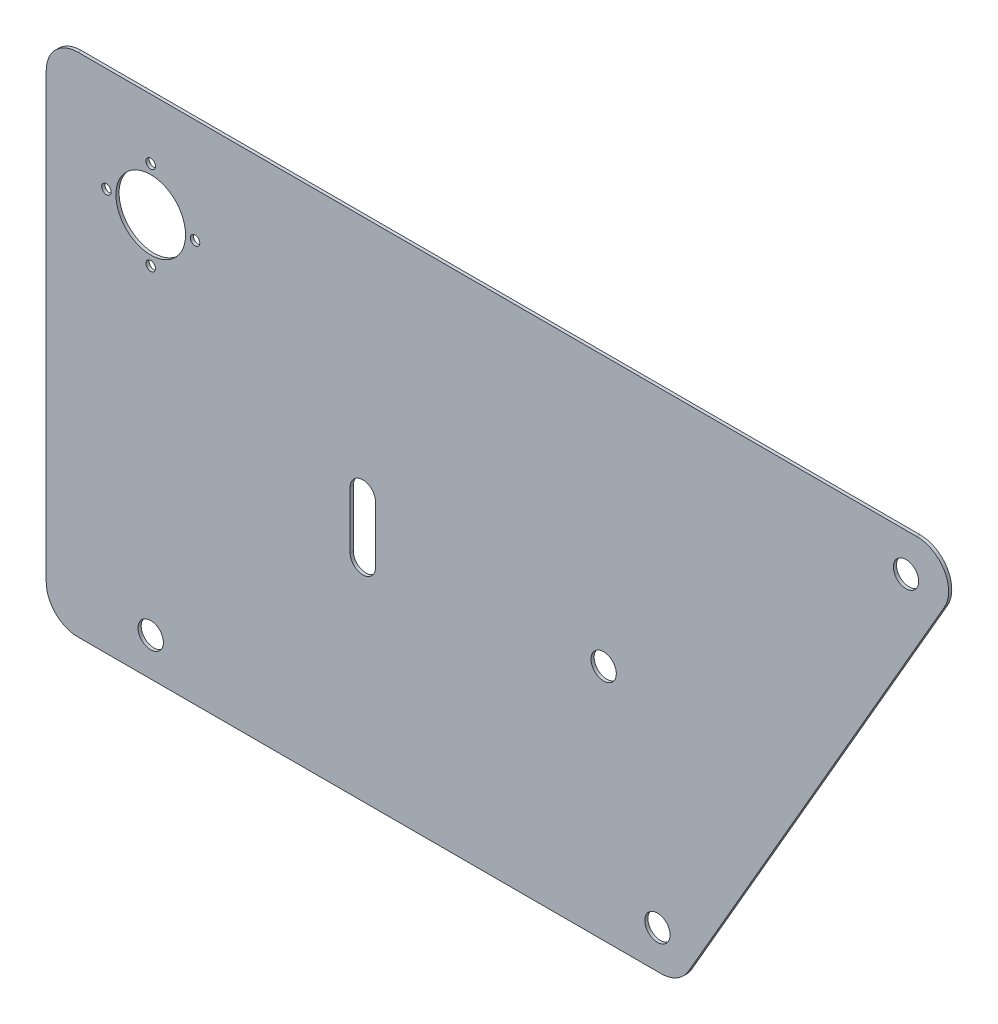
from build123d import *

# Parameters (mm, degrees)
BOSS_EXTRUDE1_DEPTH = 1
FILLET1_R           = 10
SKETCH2_R           = 4
SKETCH2_R_2         = 11
SKETCH2_R_3         = 1.5
CUT_EXTRUDE1_DEPTH  = 3


with BuildPart() as part:
    # Sketch1 → Boss-Extrude1 (new body)
    with BuildSketch(Plane.XY):
        Polygon((-100, -80), (100, -80), (192.37604307, 80), (-100, 80), align=None)
    extrude(amount=BOSS_EXTRUDE1_DEPTH)

    # Fillet1
    fillet1_edges = [part.edges().sort_by_distance(p)[0] for p in [
        (192.37604307, 80, 0.5),
        (100, -80, 0.5),
        (-100, -80, 0.5),
        (-100, 80, 0.5),
    ]]
    fillet(fillet1_edges, radius=FILLET1_R)

    # Sketch2 → Cut-Extrude1 (cut)
    with BuildSketch(Plane.XY.offset(1)):
        with Locations((93.07179677, -68)):
            Circle(SKETCH2_R)
        with Locations((171.59143338, 68)):
            Circle(SKETCH2_R)
        with Locations((-67, 47)):
            Circle(SKETCH2_R_2)
        with Locations((-67, -68)):
            Circle(SKETCH2_R)
        with Locations((-53, 47)):
            Circle(SKETCH2_R_3)
        with Locations((-67, 61)):
            Circle(SKETCH2_R_3)
        with Locations((-81, 47)):
            Circle(SKETCH2_R_3)
        with Locations((-67, 33)):
            Circle(SKETCH2_R_3)
        with Locations((76.08145631, -5)):
            Circle(SKETCH2_R)
        with BuildLine():
            Line((-4, -14), (-4, 4))
            ThreePointArc((-4, 4), (0, 8), (4, 4))
            Line((4, 4), (4, -14))
            ThreePointArc((4, -14), (0, -18), (-4, -14))
        make_face()
    extrude(amount=-CUT_EXTRUDE1_DEPTH, mode=Mode.SUBTRACT)


solid = part.part
